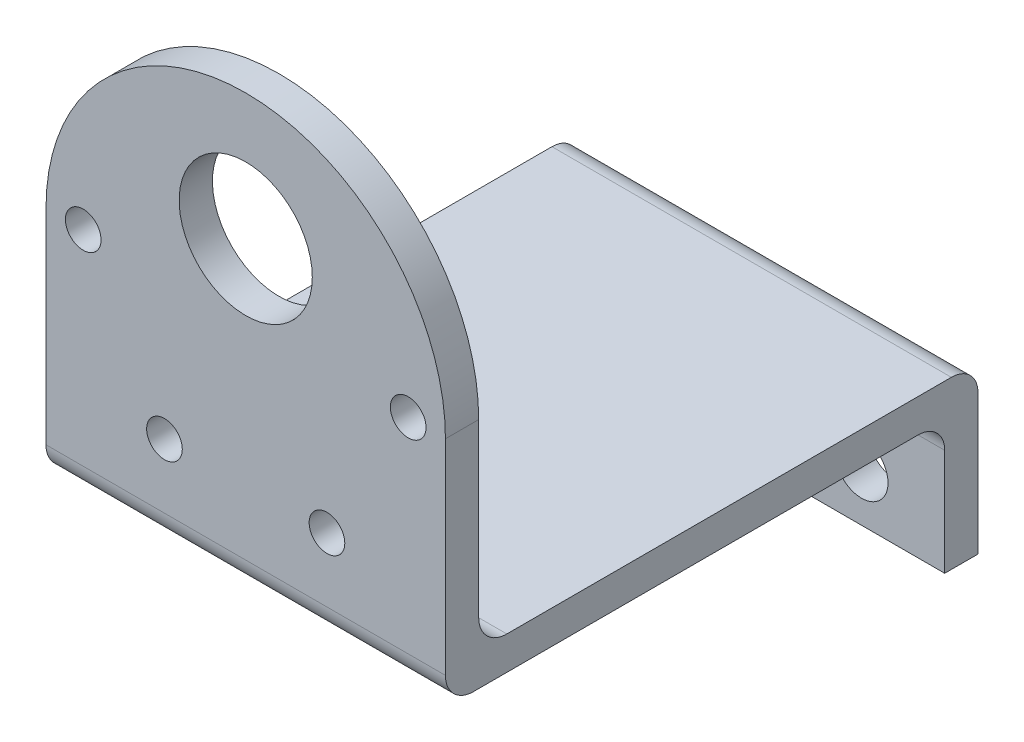
from build123d import *

# Parameters (mm, degrees)
BOSS_EXTRUDE1_DEPTH        = 38.1
F_8_0_199_DIAMETER_HOLE1_D = 5.0546
SKETCH11_R                 = 6.35
CUT_EXTRUDE1_DEPTH         = 77.185209693
M3_CLEARANCE_HOLE1_D       = 3.4


with BuildPart() as part:
    # Sketch1 → Boss-Extrude1 (new body)
    with BuildSketch(Plane(origin=(0, 0, 0), x_dir=(0, 0, -1), z_dir=(1, 0, 0))):
        with BuildLine():
            Line((0, 42.094372261), (0, 6.675328802))
            ThreePointArc((0, 6.675328802), (0.785233991, 4.779606252), (2.680956542, 3.994372261))
            Line((2.680956542, 3.994372261), (45.085, 3.994372261))
            ThreePointArc((45.085, 3.994372261), (46.881051224, 3.250423485), (47.625, 1.454372261))
            Line((47.625, 1.454372261), (47.625, -11.880627739))
            Line((47.625, -11.880627739), (44.45, -11.880627739))
            Line((44.45, -11.880627739), (44.45, -1.720627739))
            ThreePointArc((44.45, -1.720627739), (43.706051224, 0.075423485), (41.91, 0.819372261))
            Line((41.91, 0.819372261), (-0.494043458, 0.819372261))
            ThreePointArc((-0.494043458, 0.819372261), (-2.389766009, 1.604606252), (-3.175, 3.500328802))
            Line((-3.175, 3.500328802), (-3.175, 42.094372261))
            Line((-3.175, 42.094372261), (0, 42.094372261))
        make_face()
    extrude(amount=BOSS_EXTRUDE1_DEPTH)

    # #8 (0.199) Diameter Hole1 (through all)
    with Locations(Plane.XY.offset(-44.45)):
        with Locations((7.9375, -7.118127739), (30.1625, -7.118127739)):
            Hole(F_8_0_199_DIAMETER_HOLE1_D / 2)

    # Sketch11 → Cut-Extrude1 (cut, through all)
    with BuildSketch(Plane.XY.offset(3.175)):
        with BuildLine():
            Line((38.1, 42.094372261), (19.05, 42.094372261))
            ThreePointArc((19.05, 42.094372261), (32.520384182, 36.514756442), (38.1, 23.044372261))
            Line((38.1, 23.044372261), (38.1, 42.094372261))
        make_face()
        with BuildLine():
            Line((0, 42.094372261), (0, 23.044372261))
            ThreePointArc((0, 23.044372261), (5.579615818, 36.514756442), (19.05, 42.094372261))
            Line((19.05, 42.094372261), (0, 42.094372261))
        make_face()
        with Locations((19.05, 30.044372261)):
            Circle(SKETCH11_R)
    extrude(amount=-CUT_EXTRUDE1_DEPTH, mode=Mode.SUBTRACT)

    # M3 Clearance Hole1 (through all)
    with Locations(Plane.XY.offset(3.175)):
        with Locations((3.55, 23.044372261), (34.55, 23.044372261), (26.8, 9.620978502), (11.3, 9.620978502)):
            Hole(M3_CLEARANCE_HOLE1_D / 2)


solid = part.part
